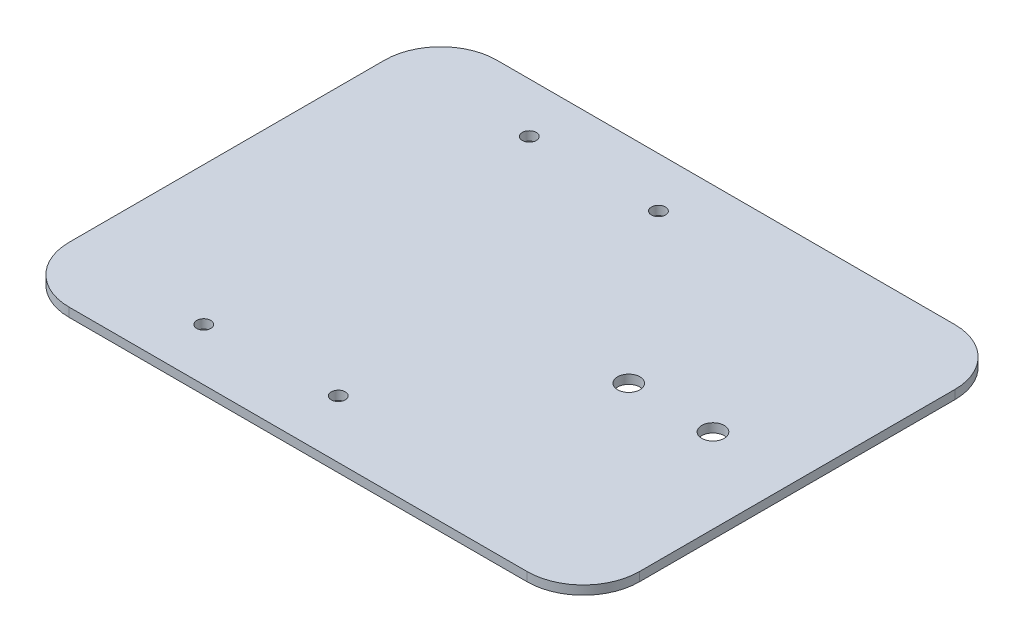
from build123d import *

# Parameters (mm, degrees)
SKETCH1_W           = 101.6
SKETCH1_H           = 76.2
BOSS_EXTRUDE1_DEPTH = 1.5875
SKETCH2_R           = 2
CUT_EXTRUDE1_DEPTH  = 64.51984065
FILLET1_R           = 10
SKETCH4_R           = 1.25
CUT_EXTRUDE2_DEPTH  = 64.51984065


with BuildPart() as part:
    # Sketch1 → Boss-Extrude1 (new body)
    with BuildSketch(Plane(origin=(0, 0, 0), x_dir=(1, 0, 0), z_dir=(0, 1, 0))):
        Rectangle(SKETCH1_W, SKETCH1_H)
    extrude(amount=BOSS_EXTRUDE1_DEPTH)

    # Sketch2 → Cut-Extrude1 (cut, through all)
    with BuildSketch(Plane(origin=(0, 1.5875, 0), x_dir=(1, 0, 0), z_dir=(0, 1, 0))):
        with Locations((35.8, 0)):
            Circle(SKETCH2_R)
        with Locations((20.8, 0)):
            Circle(SKETCH2_R)
    extrude(amount=-CUT_EXTRUDE1_DEPTH, mode=Mode.SUBTRACT)

    # Fillet1
    fillet1_edges = [part.edges().sort_by_distance(p)[0] for p in [
        (-50.8, 0.79375, -38.1),
        (-50.8, 0.79375, 38.1),
        (50.8, 0.79375, 38.1),
        (50.8, 0.79375, -38.1),
    ]]
    fillet(fillet1_edges, radius=FILLET1_R)

    # Sketch4 → Cut-Extrude2 (cut, through all)
    with BuildSketch(Plane(origin=(0, 1.5875, 0), x_dir=(1, 0, 0), z_dir=(0, 1, 0))):
        with Locations((-3.134370543, 29.218470634)):
            Circle(SKETCH4_R)
        with Locations((-3.134370543, -27.818050268)):
            Circle(SKETCH4_R)
        with Locations((-26.134370543, 29.218470634)):
            Circle(SKETCH4_R)
        with Locations((-26.134370543, -28.781529366)):
            Circle(SKETCH4_R)
    extrude(amount=-CUT_EXTRUDE2_DEPTH, mode=Mode.SUBTRACT)


solid = part.part
